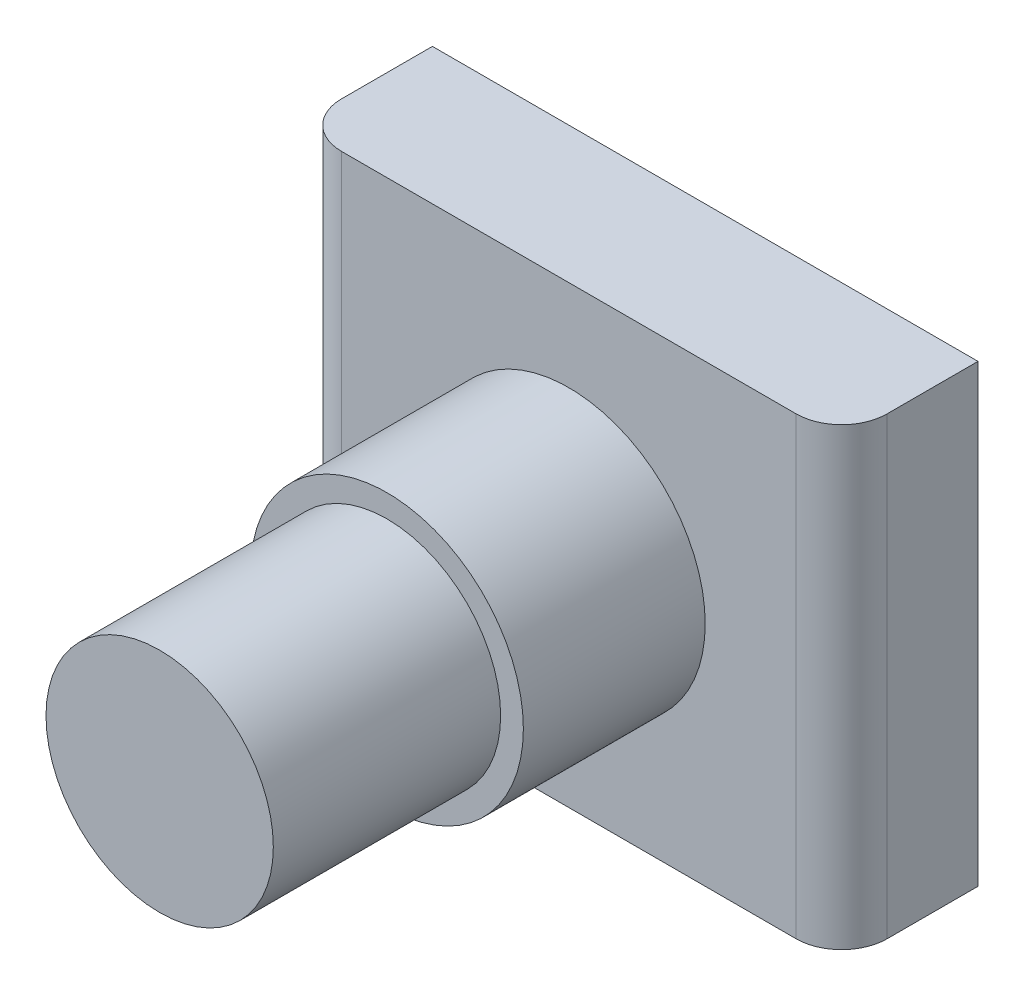
from build123d import *

# Parameters (mm, degrees)
SKETCH2_W           = 12
SKETCH2_H           = 10
BOSS_EXTRUDE1_DEPTH = 3
FILLET1_R           = 1


with BuildPart() as part:
    # Sketch2 → Boss-Extrude1 (new body)
    with BuildSketch(Plane.XY):
        Rectangle(SKETCH2_W, SKETCH2_H)
    extrude(amount=BOSS_EXTRUDE1_DEPTH)

    # Sketch3 → Revolve1 (revolve)
    with BuildSketch(Plane(origin=(0, 0, 0), x_dir=(0, 0, -1), z_dir=(1, 0, 0))):
        Polygon((-3, 0), (-3, 3), (-7, 3), (-7, 2.5), (-12, 2.5), (-12, 0), align=None)
    revolve(axis=Axis((0, 0, 12), (0, 0, -1)))

    # Fillet1
    fillet1_edges = [part.edges().sort_by_distance(p)[0] for p in [
        (6, 0, 3),
        (-6, 0, 3),
    ]]
    fillet(fillet1_edges, radius=FILLET1_R)


solid = part.part
